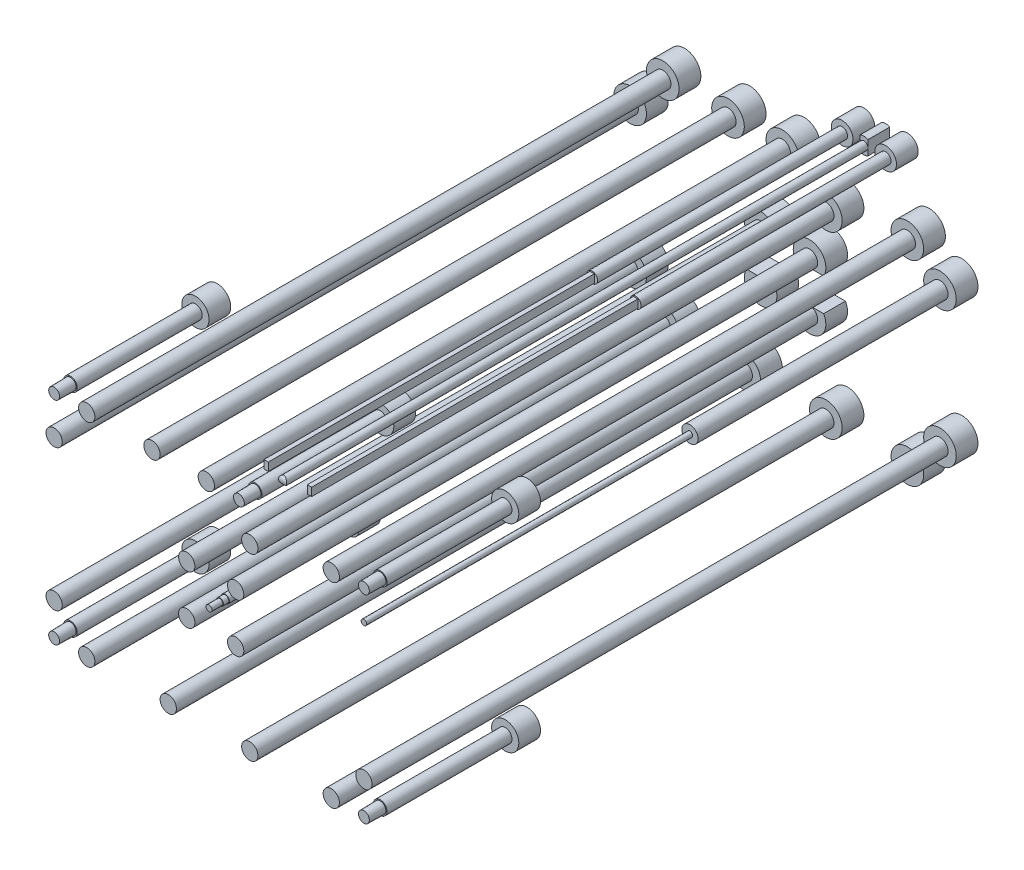
from build123d import *

# Parameters (mm, degrees)
SKETCH_1_R                     = 3
EXTRUDE_1_DEPTH                = 4
SKETCH_2_R                     = 1.5
EXTRUDE_2_DEPTH                = 110
PATTERN_SKETCH_1_OUTLINE_R     = 1.5
PATTERN_SKETCH_1_DEPTH         = 110
PATTERN_SKETCH_1_2_OUTLINE_R   = 3
PATTERN_SKETCH_1_2_OUTLINE_R_2 = 1.5
PATTERN_SKETCH_1_2_DEPTH       = 4
SKETCH_4_R                     = 3
EXTRUDE_3_DEPTH                = 4
SKETCH_5_R                     = 1.5
EXTRUDE_4_DEPTH                = 50
SKETCH_8_R                     = 0.5
EXTRUDE_5_DEPTH                = 110
SKETCH_6_W                     = 40
SKETCH_6_H                     = 20
CUT_EXTRUDE_1_DEPTH            = 0.4
SKETCH_35_W                    = 19.384257682
SKETCH_35_H                    = 6
CUT_EXTRUDE_10_DEPTH           = 10
SKETCH_20_R                    = 2.5
EXTRUDE_8_DEPTH                = 4
SKETCH_19_R                    = 1.25
EXTRUDE_9_DEPTH                = 27
SKETCH_21_R                    = 1
EXTRUDE_10_DEPTH               = 30
DRAFT_1_ANGLE                  = 1
SKETCH_23_R                    = 1.5
EXTRUDE_11_DEPTH               = 4
SKETCH_24_R                    = 0.75
EXTRUDE_12_DEPTH               = 112
CUT_EXTRUDE_8_DEPTH            = 137.803691471
SKETCH_25_R                    = 1.5
EXTRUDE_13_DEPTH               = 4
SKETCH_26_R                    = 0.75
EXTRUDE_14_DEPTH               = 27
SKETCH_27_R                    = 0.65
EXTRUDE_15_DEPTH               = 28
SKETCH_28_R                    = 0.55
EXTRUDE_16_DEPTH               = 30
SKETCH_30_R                    = 2
EXTRUDE_17_DEPTH               = 4
SKETCH_31_R                    = 1
EXTRUDE_18_DEPTH               = 50
SKETCH_32_W                    = 0.8
SKETCH_32_H                    = 1.5
EXTRUDE_19_DEPTH               = 110
PATTERN_SKETCH_4_OUTLINE_R     = 1
PATTERN_SKETCH_4_DEPTH         = 50
PATTERN_START                  = 50
PATTERN_SKETCH_4_2_OUTLINE_W   = 0.8
PATTERN_SKETCH_4_2_OUTLINE_H   = 1.5
PATTERN_SKETCH_4_2_DEPTH       = 60
PATTERN_SKETCH_4_3_OUTLINE_R   = 2
PATTERN_SKETCH_4_3_OUTLINE_R_2 = 1
PATTERN_SKETCH_4_3_DEPTH       = 4
CUT_EXTRUDE_START              = 76
CUT_EXTRUDE_9_DEPTH            = 4


# Read off the part's stored shape, not the designer's step: ｽｹｯﾁ-ﾊﾟﾀｰﾝ1, ｽｹｯﾁ-ﾊﾟﾀｰﾝ3, ｽｹｯﾁ-ﾊﾟﾀｰﾝ4, ｶｯﾄ - 押し出し9
with BuildPart() as part:
    # ｽｹｯﾁ1 → ﾎﾞｽ - 押し出し1 (new body)
    with BuildSketch(Plane.XY):
        with Locations((1, 7)):
            Circle(SKETCH_1_R)
    extrude(amount=EXTRUDE_1_DEPTH)

    # ｽｹｯﾁ2 → ﾎﾞｽ - 押し出し2 (add)
    with BuildSketch(Plane.XY):
        with Locations((1, 7)):
            Circle(SKETCH_2_R)
    extrude(amount=EXTRUDE_2_DEPTH)


with BuildPart() as body_2:
    # ｽｹｯﾁ-ﾊﾟﾀｰﾝ1 outline → ｽｹｯﾁ-ﾊﾟﾀｰﾝ1 (new body)
    with BuildSketch(Plane.XY):
        with Locations((1, 33)):
            Circle(PATTERN_SKETCH_1_OUTLINE_R)
        with Locations((34, 25)):
            Circle(PATTERN_SKETCH_1_OUTLINE_R)
        with Locations((34, 16)):
            Circle(PATTERN_SKETCH_1_OUTLINE_R)
        with Locations((25, 16)):
            Circle(PATTERN_SKETCH_1_OUTLINE_R)
        with Locations((37, 34)):
            Circle(PATTERN_SKETCH_1_OUTLINE_R)
        with Locations((25, 25)):
            Circle(PATTERN_SKETCH_1_OUTLINE_R)
        with Locations((58, 7)):
            Circle(PATTERN_SKETCH_1_OUTLINE_R)
        with Locations((52, 37)):
            Circle(PATTERN_SKETCH_1_OUTLINE_R)
        with Locations((29, 40)):
            Circle(PATTERN_SKETCH_1_OUTLINE_R)
        with Locations((19, 40)):
            Circle(PATTERN_SKETCH_1_OUTLINE_R)
        with Locations((7, 40)):
            Circle(PATTERN_SKETCH_1_OUTLINE_R)
        with Locations((52, 1)):
            Circle(PATTERN_SKETCH_1_OUTLINE_R)
        with Locations((37, 1)):
            Circle(PATTERN_SKETCH_1_OUTLINE_R)
        with Locations((22, 1)):
            Circle(PATTERN_SKETCH_1_OUTLINE_R)
        with Locations((7, 1)):
            Circle(PATTERN_SKETCH_1_OUTLINE_R)
    extrude(amount=PATTERN_SKETCH_1_DEPTH)

    # Pattern Sketch 1 2 outline → Pattern Sketch 1 2 (add)
    # profile 1 of 15: a face of its own
    with BuildSketch(Plane.XY):
        with Locations((1, 33)):
            Circle(PATTERN_SKETCH_1_2_OUTLINE_R)
        with Locations((1, 33)):
            Circle(PATTERN_SKETCH_1_2_OUTLINE_R_2, mode=Mode.SUBTRACT)
    # profile 2 of 15: a face of its own
    with BuildSketch(Plane.XY):
        with Locations((34, 25)):
            Circle(PATTERN_SKETCH_1_2_OUTLINE_R)
        with Locations((34, 25)):
            Circle(PATTERN_SKETCH_1_2_OUTLINE_R_2, mode=Mode.SUBTRACT)
    # profile 3 of 15: a face of its own
    with BuildSketch(Plane.XY):
        with Locations((34, 16)):
            Circle(PATTERN_SKETCH_1_2_OUTLINE_R)
        with Locations((34, 16)):
            Circle(PATTERN_SKETCH_1_2_OUTLINE_R_2, mode=Mode.SUBTRACT)
    # profile 4 of 15: a face of its own
    with BuildSketch(Plane.XY):
        with Locations((25, 16)):
            Circle(PATTERN_SKETCH_1_2_OUTLINE_R)
        with Locations((25, 16)):
            Circle(PATTERN_SKETCH_1_2_OUTLINE_R_2, mode=Mode.SUBTRACT)
    # profile 5 of 15: a face of its own
    with BuildSketch(Plane.XY):
        with Locations((37, 34)):
            Circle(PATTERN_SKETCH_1_2_OUTLINE_R)
        with Locations((37, 34)):
            Circle(PATTERN_SKETCH_1_2_OUTLINE_R_2, mode=Mode.SUBTRACT)
    # profile 6 of 15: a face of its own
    with BuildSketch(Plane.XY):
        with Locations((25, 25)):
            Circle(PATTERN_SKETCH_1_2_OUTLINE_R)
        with Locations((25, 25)):
            Circle(PATTERN_SKETCH_1_2_OUTLINE_R_2, mode=Mode.SUBTRACT)
    # profile 7 of 15: a face of its own
    with BuildSketch(Plane.XY):
        with Locations((58, 7)):
            Circle(PATTERN_SKETCH_1_2_OUTLINE_R)
        with Locations((58, 7)):
            Circle(PATTERN_SKETCH_1_2_OUTLINE_R_2, mode=Mode.SUBTRACT)
    # profile 8 of 15: a face of its own
    with BuildSketch(Plane.XY):
        with Locations((52, 37)):
            Circle(PATTERN_SKETCH_1_2_OUTLINE_R)
        with Locations((52, 37)):
            Circle(PATTERN_SKETCH_1_2_OUTLINE_R_2, mode=Mode.SUBTRACT)
    # profile 9 of 15: a face of its own
    with BuildSketch(Plane.XY):
        with Locations((29, 40)):
            Circle(PATTERN_SKETCH_1_2_OUTLINE_R)
        with Locations((29, 40)):
            Circle(PATTERN_SKETCH_1_2_OUTLINE_R_2, mode=Mode.SUBTRACT)
    # profile 10 of 15: a face of its own
    with BuildSketch(Plane.XY):
        with Locations((19, 40)):
            Circle(PATTERN_SKETCH_1_2_OUTLINE_R)
        with Locations((19, 40)):
            Circle(PATTERN_SKETCH_1_2_OUTLINE_R_2, mode=Mode.SUBTRACT)
    # profile 11 of 15: a face of its own
    with BuildSketch(Plane.XY):
        with Locations((7, 40)):
            Circle(PATTERN_SKETCH_1_2_OUTLINE_R)
        with Locations((7, 40)):
            Circle(PATTERN_SKETCH_1_2_OUTLINE_R_2, mode=Mode.SUBTRACT)
    # profile 12 of 15: a face of its own
    with BuildSketch(Plane.XY):
        with Locations((52, 1)):
            Circle(PATTERN_SKETCH_1_2_OUTLINE_R)
        with Locations((52, 1)):
            Circle(PATTERN_SKETCH_1_2_OUTLINE_R_2, mode=Mode.SUBTRACT)
    # profile 13 of 15: a face of its own
    with BuildSketch(Plane.XY):
        with Locations((37, 1)):
            Circle(PATTERN_SKETCH_1_2_OUTLINE_R)
        with Locations((37, 1)):
            Circle(PATTERN_SKETCH_1_2_OUTLINE_R_2, mode=Mode.SUBTRACT)
    # profile 14 of 15: a face of its own
    with BuildSketch(Plane.XY):
        with Locations((22, 1)):
            Circle(PATTERN_SKETCH_1_2_OUTLINE_R)
        with Locations((22, 1)):
            Circle(PATTERN_SKETCH_1_2_OUTLINE_R_2, mode=Mode.SUBTRACT)
    # profile 15 of 15: a face of its own
    with BuildSketch(Plane.XY):
        with Locations((7, 1)):
            Circle(PATTERN_SKETCH_1_2_OUTLINE_R)
        with Locations((7, 1)):
            Circle(PATTERN_SKETCH_1_2_OUTLINE_R_2, mode=Mode.SUBTRACT)
    extrude(amount=PATTERN_SKETCH_1_2_DEPTH)

    # ｽｹｯﾁ6 → ｶｯﾄ - 押し出し1 (cut)
    with BuildSketch(Plane.XY.offset(110)):
        with Locations((30, 20)):
            Rectangle(SKETCH_6_W, SKETCH_6_H)
    extrude(amount=-CUT_EXTRUDE_1_DEPTH, mode=Mode.SUBTRACT)

    # ｽｹｯﾁ35 → ｶｯﾄ - 押し出し10 (cut)
    with BuildSketch(Plane.XY):
        with Locations((29.319780458, 20.5)):
            Rectangle(SKETCH_35_W, SKETCH_35_H)
    extrude(amount=CUT_EXTRUDE_10_DEPTH, mode=Mode.SUBTRACT)


with BuildPart() as body_3:
    # ｽｹｯﾁ4 → ﾎﾞｽ - 押し出し3 (new body)
    with BuildSketch(Plane.XY):
        with Locations((58, 32)):
            Circle(SKETCH_4_R)
    extrude(amount=EXTRUDE_3_DEPTH)

    # ｽｹｯﾁ5 → ﾎﾞｽ - 押し出し4 (add)
    with BuildSketch(Plane.XY):
        with Locations((58, 32)):
            Circle(SKETCH_5_R)
    extrude(amount=EXTRUDE_4_DEPTH)

    # ｽｹｯﾁ8 → ﾎﾞｽ - 押し出し5 (add)
    with BuildSketch(Plane.XY):
        with Locations((58, 32)):
            Circle(SKETCH_8_R)
    extrude(amount=EXTRUDE_5_DEPTH)


with BuildPart() as body_4:
    # ｽｹｯﾁ20 → ﾎﾞｽ - 押し出し8 (new body)
    with BuildSketch(Plane(origin=(0, 0, 80), x_dir=(-1, 0, 0), z_dir=(0, 0, -1))):
        with Locations((-1, 1)):
            Circle(SKETCH_20_R)
    extrude(amount=-EXTRUDE_8_DEPTH)

    # ｽｹｯﾁ19 → ﾎﾞｽ - 押し出し9 (add)
    with BuildSketch(Plane(origin=(0, 0, 80), x_dir=(-1, 0, 0), z_dir=(0, 0, -1))):
        with Locations((-1, 1)):
            Circle(SKETCH_19_R)
    extrude(amount=-EXTRUDE_9_DEPTH)

    # ｽｹｯﾁ21 → ﾎﾞｽ - 押し出し10 (add)
    with BuildSketch(Plane(origin=(0, 0, 80), x_dir=(-1, 0, 0), z_dir=(0, 0, -1))):
        with Locations((-1, 1)):
            Circle(SKETCH_21_R)
    extrude(amount=-EXTRUDE_10_DEPTH)

    # 抜き勾配1
    draft_1_faces = [body_4.faces().sort_by_distance(p)[0] for p in [
        (2, 1, 108.5),
    ]]
    draft(draft_1_faces, Plane(origin=(1, 1, 110), x_dir=(1, 0, 0), z_dir=(0, 0, 1)), DRAFT_1_ANGLE)


with BuildPart() as body_5:
    # ｽｹｯﾁ-ﾊﾟﾀｰﾝ3 outline → ｽｹｯﾁ-ﾊﾟﾀｰﾝ3 (revolve)
    with BuildSketch(Plane(origin=(35, 40, 0), x_dir=(1, 0, 0), z_dir=(0, -1, 0))):
        Polygon((2.5, 80), (2.5, 84), (1.25, 84), (1.25, 107), (1.052365195, 107), (1, 110), (0, 110), (0, 80), align=None)
    revolve(axis=Axis((35, 40, 0), (0, 0, 1)))


with BuildPart() as body_6:
    # Pattern Sketch 3 2 outline → Pattern Sketch 3 2 (revolve)
    with BuildSketch(Plane(origin=(58, 1, 0), x_dir=(1, 0, 0), z_dir=(0, -1, 0))):
        Polygon((0, 80), (2.5, 80), (2.5, 84), (1.25, 84), (1.25, 107), (1.052365195, 107), (1, 110), (0, 110), align=None)
    revolve(axis=Axis((58, 1, 0), (0, 0, 1)))


with BuildPart() as body_7:
    # Pattern Sketch 3 3 outline → Pattern Sketch 3 3 (revolve)
    with BuildSketch(Plane(origin=(58, 37.5, 0), x_dir=(1, 0, 0), z_dir=(0, -1, 0))):
        Polygon((0, 80), (2.5, 80), (2.5, 84), (1.25, 84), (1.25, 107), (1.052365195, 107), (1, 110), (0, 110), align=None)
    revolve(axis=Axis((58, 37.5, 0), (0, 0, 1)))


with BuildPart() as body_8:
    # Pattern Sketch 3 4 outline → Pattern Sketch 3 4 (revolve)
    with BuildSketch(Plane(origin=(1, 40, 0), x_dir=(1, 0, 0), z_dir=(0, -1, 0))):
        Polygon((0, 80), (2.5, 80), (2.5, 84), (1.25, 84), (1.25, 107), (1.052365195, 107), (1, 110), (0, 110), align=None)
    revolve(axis=Axis((1, 40, 0), (0, 0, 1)))


with BuildPart() as body_9:
    # ｽｹｯﾁ23 → ﾎﾞｽ - 押し出し11 (new body)
    with BuildSketch(Plane.XY):
        with Locations((44, 48)):
            Circle(SKETCH_23_R)
    extrude(amount=EXTRUDE_11_DEPTH)

    # ｽｹｯﾁ24 → ﾎﾞｽ - 押し出し12 (add)
    with BuildSketch(Plane.XY):
        with Locations((44, 48)):
            Circle(SKETCH_24_R)
    extrude(amount=EXTRUDE_12_DEPTH)

    # ｽｹｯﾁ18 → ｶｯﾄ - 押し出し8 (cut, through all)
    with BuildSketch(Plane(origin=(0, 0, 0), x_dir=(0, 0, -1), z_dir=(1, 0, 0))):
        with BuildLine():
            Line((-110, 49), (-110, 53))
            Line((-110, 53), (-120, 53))
            Line((-120, 53), (-120, 43))
            Line((-120, 43), (-110, 43))
            Line((-110, 43), (-110, 47))
            ThreePointArc((-110, 47), (-111, 48), (-110, 49))
        make_face()
    extrude(amount=CUT_EXTRUDE_8_DEPTH, mode=Mode.SUBTRACT)

    # ｶｯﾄ - 押し出し9 outline → ｶｯﾄ - 押し出し9 (cut)
    with BuildSketch(Plane(origin=(0, 0, 80), x_dir=(-1, 0, 0), z_dir=(0, 0, -1)).offset(CUT_EXTRUDE_START)):
        with BuildLine():
            Line((-44.75, 46.700961894), (-44.75, 49.299038106))
            ThreePointArc((-44.75, 49.299038106), (-45.5, 48), (-44.75, 46.700961894))
        make_face()
        with BuildLine():
            ThreePointArc((-43.25, 46.700961894), (-42.5, 48), (-43.25, 49.299038106))
            Line((-43.25, 49.299038106), (-43.25, 46.700961894))
        make_face()
    extrude(amount=CUT_EXTRUDE_9_DEPTH, mode=Mode.SUBTRACT)


with BuildPart() as body_10:
    # ｽｹｯﾁ25 → ﾎﾞｽ - 押し出し13 (new body)
    with BuildSketch(Plane(origin=(0, 0, 80), x_dir=(-1, 0, 0), z_dir=(0, 0, -1))):
        with Locations((-29.5, 20)):
            Circle(SKETCH_25_R)
    extrude(amount=-EXTRUDE_13_DEPTH)

    # ｽｹｯﾁ26 → ﾎﾞｽ - 押し出し14 (add)
    with BuildSketch(Plane(origin=(0, 0, 80), x_dir=(-1, 0, 0), z_dir=(0, 0, -1))):
        with Locations((-29.5, 20)):
            Circle(SKETCH_26_R)
    extrude(amount=-EXTRUDE_14_DEPTH)

    # ｽｹｯﾁ27 → ﾎﾞｽ - 押し出し15 (add)
    with BuildSketch(Plane(origin=(0, 0, 80), x_dir=(-1, 0, 0), z_dir=(0, 0, -1))):
        with Locations((-29.5, 20)):
            Circle(SKETCH_27_R)
    extrude(amount=-EXTRUDE_15_DEPTH)

    # ｽｹｯﾁ28 → ﾎﾞｽ - 押し出し16 (add)
    with BuildSketch(Plane(origin=(0, 0, 80), x_dir=(-1, 0, 0), z_dir=(0, 0, -1))):
        with Locations((-29.5, 20)):
            Circle(SKETCH_28_R)
    extrude(amount=-EXTRUDE_16_DEPTH)


with BuildPart() as body_11:
    # ｽｹｯﾁ30 → ﾎﾞｽ - 押し出し17 (new body)
    with BuildSketch(Plane.XY):
        with Locations((48, 48)):
            Circle(SKETCH_30_R)
    extrude(amount=EXTRUDE_17_DEPTH)

    # ｽｹｯﾁ31 → ﾎﾞｽ - 押し出し18 (add)
    with BuildSketch(Plane.XY):
        with Locations((48, 48)):
            Circle(SKETCH_31_R)
    extrude(amount=EXTRUDE_18_DEPTH)

    # ｽｹｯﾁ32 → ﾎﾞｽ - 押し出し19 (add)
    with BuildSketch(Plane.XY):
        with Locations((48, 48)):
            Rectangle(SKETCH_32_W, SKETCH_32_H)
    extrude(amount=EXTRUDE_19_DEPTH)


with BuildPart() as body_12:
    # ｽｹｯﾁ-ﾊﾟﾀｰﾝ4 outline → ｽｹｯﾁ-ﾊﾟﾀｰﾝ4 (new body)
    with BuildSketch(Plane.XY):
        with Locations((40, 48)):
            Circle(PATTERN_SKETCH_4_OUTLINE_R)
    extrude(amount=PATTERN_SKETCH_4_DEPTH)

    # Pattern Sketch 4 2 outline → Pattern Sketch 4 2 (add)
    with BuildSketch(Plane.XY.offset(PATTERN_START)):
        with Locations((40, 48)):
            Rectangle(PATTERN_SKETCH_4_2_OUTLINE_W, PATTERN_SKETCH_4_2_OUTLINE_H)
    extrude(amount=PATTERN_SKETCH_4_2_DEPTH)

    # Pattern Sketch 4 3 outline → Pattern Sketch 4 3 (add)
    with BuildSketch(Plane.XY):
        with Locations((40, 48)):
            Circle(PATTERN_SKETCH_4_3_OUTLINE_R)
        with Locations((40, 48)):
            Circle(PATTERN_SKETCH_4_3_OUTLINE_R_2, mode=Mode.SUBTRACT)
    extrude(amount=PATTERN_SKETCH_4_3_DEPTH)


solid = Compound([part.part, body_2.part, body_3.part, body_4.part, body_5.part, body_6.part, body_7.part, body_8.part, body_9.part, body_10.part, body_11.part, body_12.part])
